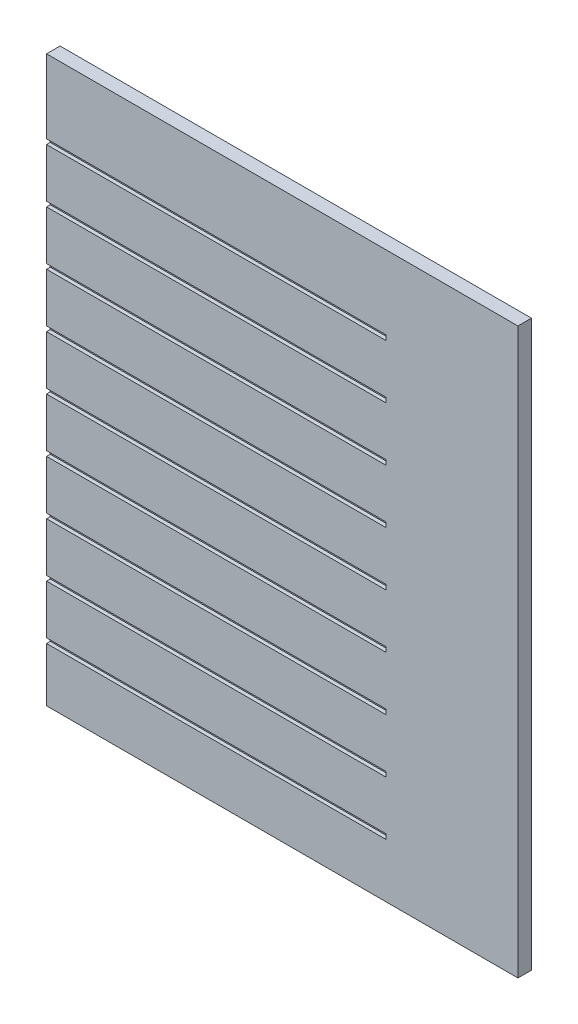
from build123d import *

# Parameters (mm, degrees)
PARTSCAB_REFERENCE_START = -740.027426398
PARTSCAB_REFERENCE_DEPTH = 1475.316666666
SKETCH1_W                = 865.716666666
SKETCH1_H                = 730.25
CUT_EXTRUDE1_DEPTH       = 840.500444405
BOSS_EXTRUDE1_REACH      = 841.5
SKETCH2_W                = 170.721463347
SKETCH2_H                = 730.25


# Read off the part's stored shape, not the designer's step: PartsCab_Reference
with BuildPart() as part:
    # PartsCab_Reference outline → PartsCab_Reference (new body)
    with BuildSketch(Plane.YZ.offset(PARTSCAB_REFERENCE_START)):
        Polygon((-395.998764796, 30.962918268), (-395.998764796, 13.487718268), (-326.148764796, 13.487718268), (-326.148764796, 18.250218268), (-319.798764796, 18.250218268), (-319.798764796, 13.487718268), (-256.298764796, 13.487718268), (-256.298764796, 18.250218268), (-249.948764796, 18.250218268), (-249.948764796, 13.487718268), (-186.448764796, 13.487718268), (-186.448764796, 18.250218268), (-180.098764796, 18.250218268), (-180.098764796, 13.487718268), (-116.598764796, 13.487718268), (-116.598764796, 18.250218268), (-110.248764796, 18.250218268), (-110.248764796, 13.487718268), (-46.748764796, 13.487718268), (-46.748764796, 18.250218268), (-40.398764796, 18.250218268), (-40.398764796, 13.487718268), (23.101235204, 13.487718268), (23.101235204, 18.250218268), (29.451235204, 18.250218268), (29.451235204, 13.487718268), (92.951235204, 13.487718268), (92.951235204, 18.250218268), (99.301235204, 18.250218268), (99.301235204, 13.487718268), (162.801235204, 13.487718268), (162.801235204, 18.250218268), (169.151235204, 18.250218268), (169.151235204, 13.487718268), (232.651235204, 13.487718268), (232.651235204, 18.250218268), (239.001235204, 18.250218268), (239.001235204, 13.487718268), (334.251235204, 13.487718268), (334.251235204, 30.962918268), (239.001235204, 30.962918268), (239.001235204, 26.200418268), (232.651235204, 26.200418268), (232.651235204, 30.962918268), (169.151235204, 30.962918268), (169.151235204, 26.200418268), (162.801235204, 26.200418268), (162.801235204, 30.962918268), (99.301235204, 30.962918268), (99.301235204, 26.200418268), (92.951235204, 26.200418268), (92.951235204, 30.962918268), (29.451235204, 30.962918268), (29.451235204, 26.200418268), (23.101235204, 26.200418268), (23.101235204, 30.962918268), (-40.398764796, 30.962918268), (-40.398764796, 26.200418268), (-46.748764796, 26.200418268), (-46.748764796, 30.962918268), (-110.248764796, 30.962918268), (-110.248764796, 26.200418268), (-116.598764796, 26.200418268), (-116.598764796, 30.962918268), (-180.098764796, 30.962918268), (-180.098764796, 26.200418268), (-186.448764796, 26.200418268), (-186.448764796, 30.962918268), (-249.948764796, 30.962918268), (-249.948764796, 26.200418268), (-256.298764796, 26.200418268), (-256.298764796, 30.962918268), (-319.798764796, 30.962918268), (-319.798764796, 26.200418268), (-326.148764796, 26.200418268), (-326.148764796, 30.962918268), align=None)
    extrude(amount=PARTSCAB_REFERENCE_DEPTH)

    # Sketch1 → Cut-Extrude1 (cut, through all)
    with BuildSketch(Plane.XY.offset(30.962918268)):
        with Locations((302.430906935, -30.873764796)):
            Rectangle(SKETCH1_W, SKETCH1_H)
    extrude(amount=-CUT_EXTRUDE1_DEPTH, mode=Mode.SUBTRACT)

    # Boss-Extrude1: up to this face of the body (flat: up to its plane)
    boss_extrude1_end = Plane(part.part.faces().sort_by_distance((-435.227426398, -361.073764796, 13.487718268))[0])
    # Sketch2 → Boss-Extrude1 (add, up to the picked face)
    with BuildSketch(Plane.XY.offset(30.962918268), mode=Mode.PRIVATE) as boss_extrude1_sk1:
        with Locations((-215.788158071, -30.873764796)):
            Rectangle(SKETCH2_W, SKETCH2_H)
    boss_extrude1_tool1 = split(extrude(boss_extrude1_sk1.sketch, amount=-BOSS_EXTRUDE1_REACH, mode=Mode.PRIVATE), bisect_by=boss_extrude1_end, keep=Keep.BOTH, mode=Mode.PRIVATE)
    add(boss_extrude1_tool1.solids().sort_by(Axis((-215.788158, -30.873765, 30.962918), (0, 0, -1)))[0])


solid = part.part
